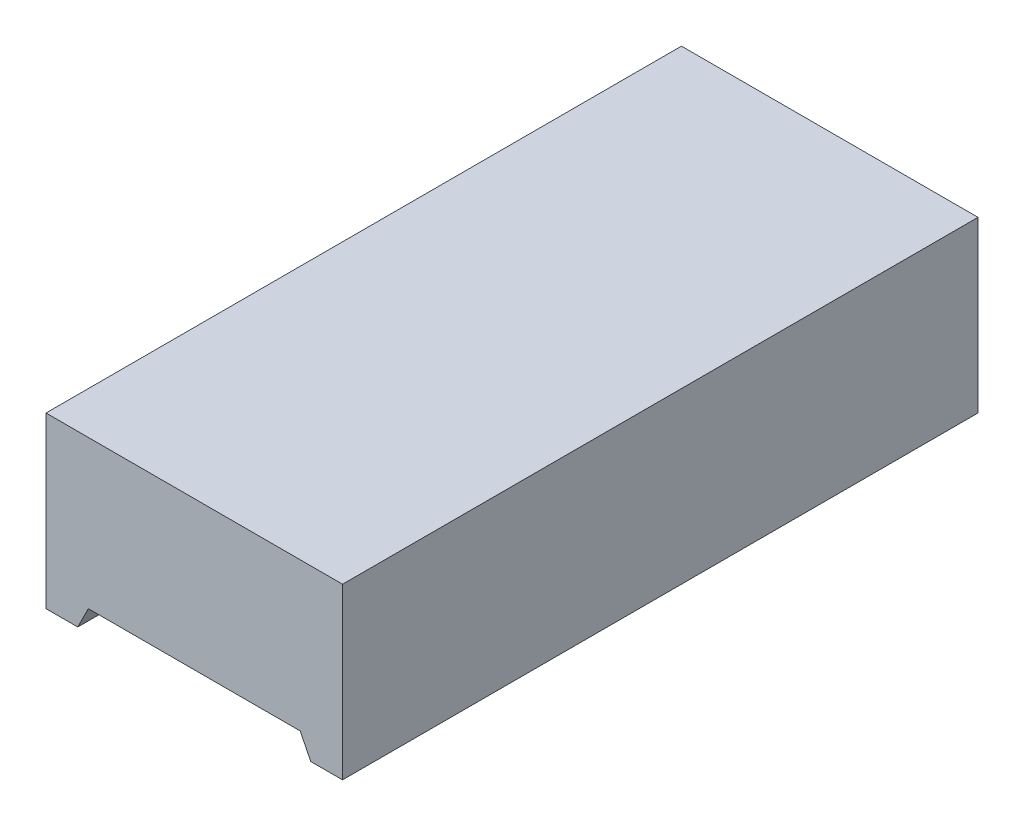
from build123d import *

# Parameters (mm, degrees)
BOSS_EXTRU_1_DEPTH = 15


with BuildPart() as part:
    # Esquisse1 → Boss.-Extru.1 (new, symmetric)
    with BuildSketch(Plane.XY):
        Polygon((7, 0), (7, 8), (-7, 8), (-7, 0), (-5.5, 0), (-5, 1), (5, 1), (5.5, 0), align=None)
    extrude(amount=BOSS_EXTRU_1_DEPTH, both=True)


solid = part.part
